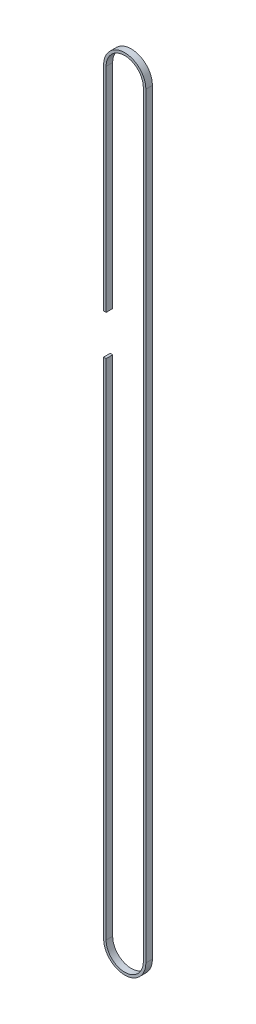
from build123d import *

# Parameters (mm, degrees)
BOSS_EXTRUDE1_DEPTH = 3.8989


with BuildPart() as part:
    # Sketch1 → Boss-Extrude1 (new, symmetric)
    with BuildSketch(Plane.XY):
        with BuildLine():
            Line((-25.1587, 901.7), (-25.1587, 647.7))
            Line((-25.1587, 647.7), (-22.1615, 647.7))
            Line((-22.1615, 647.7), (-22.1615, 901.7))
            ThreePointArc((-22.1615, 901.7), (0, 923.8615), (22.1615, 901.7))
            Line((22.1615, 901.7), (22.1615, 0))
            ThreePointArc((22.1615, 0), (0, -22.1615), (-22.1615, 0))
            Line((-22.1615, 0), (-22.1615, 600.075))
            Line((-22.1615, 600.075), (-25.1587, 600.075))
            Line((-25.1587, 600.075), (-25.1587, 0))
            ThreePointArc((-25.1587, 0), (0, -25.1587), (25.1587, 0))
            Line((25.1587, 0), (25.1587, 901.7))
            ThreePointArc((25.1587, 901.7), (0, 926.8587), (-25.1587, 901.7))
        make_face()
    extrude(amount=BOSS_EXTRUDE1_DEPTH, both=True)


solid = part.part
